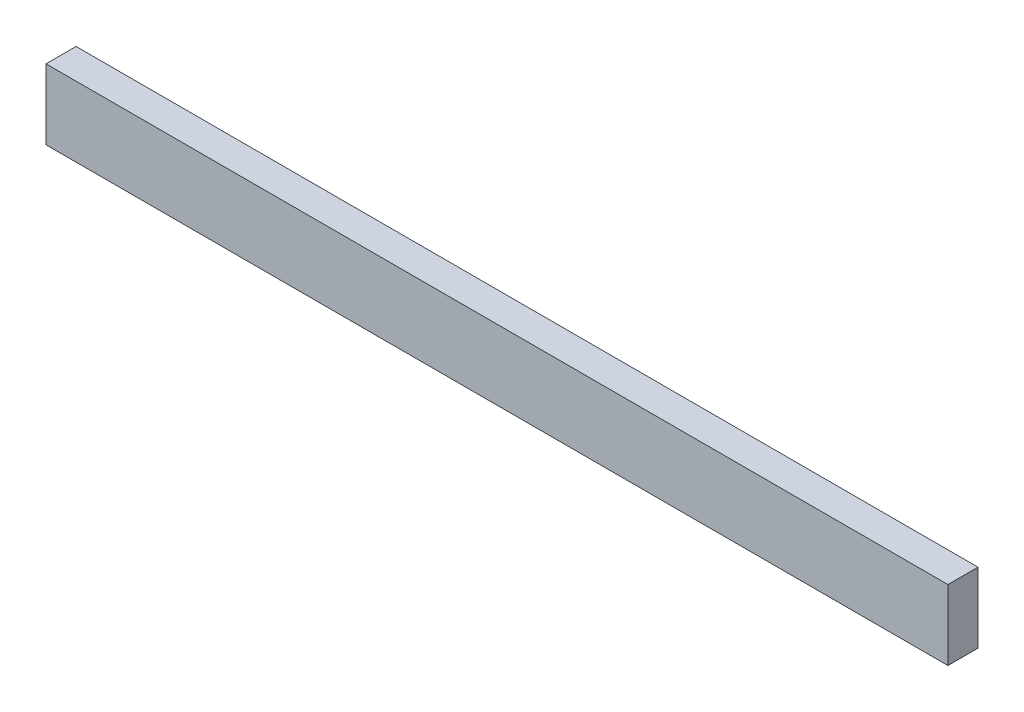
from build123d import *

# Parameters (mm, degrees)
BOSS_EXTRUDE1_DEPTH      = 19.05
BOSS_EXTRUDE1_DEPTH_BACK = 19.05
SKETCH1_W                = 1143
SKETCH1_H                = 88.9


with BuildPart() as part:
    # Sketch1 → Boss-Extrude1 (new, two sides: drawn at the far end of the back side and taken through both)
    with BuildSketch(Plane.XY.offset(-BOSS_EXTRUDE1_DEPTH_BACK)):
        Rectangle(SKETCH1_W, SKETCH1_H)
    extrude(amount=BOSS_EXTRUDE1_DEPTH + BOSS_EXTRUDE1_DEPTH_BACK)


solid = part.part
